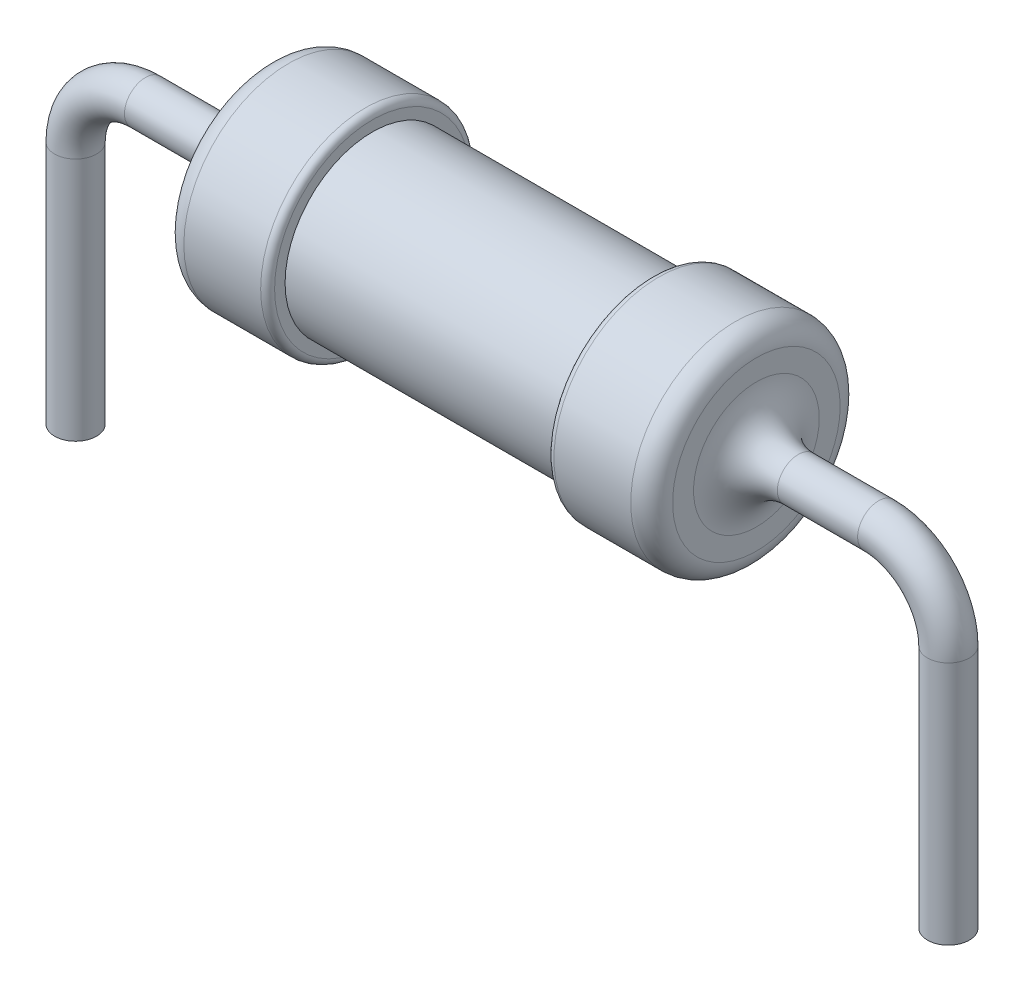
from build123d import *

# Parameters (mm, degrees)
SKETCH_1_R           = 1.25
EXTRUDE_1_DEPTH      = 2.5
EXTRUDE_3_DEPTH      = 1
EXTRUDE_3_DEPTH_BACK = 0.5
SKETCH_2_R           = 1.5
EXTRUDE_4_DEPTH      = 1
EXTRUDE_4_DEPTH_BACK = 0.5
SKETCH_3_R           = 1.5
SWEEP_1_OUTLINE_R    = 0.3
SWEEP_1_ANGLE        = 90
SWEEP_1_2_OUTLINE_R  = 0.3
SWEEP_1_2_ANGLE      = 90
SWEEP_START          = -4.5
SWEEP_1_3_OUTLINE_R  = 0.3
SWEEP_1_3_DEPTH      = 3.5000001
SWEEP_START_2        = -5.2500001
SWEEP_1_4_OUTLINE_R  = 0.3
SWEEP_1_4_DEPTH      = 2.2500001
SWEEP_START_3        = 3
SWEEP_1_5_OUTLINE_R  = 0.3
SWEEP_1_5_DEPTH      = 2.2500001
SWEEP_1_6_OUTLINE_R  = 0.3
SWEEP_1_6_DEPTH      = 3.5000001
FILLET_1_R           = 0.6
FILLET_2_R           = 0.3
FILLET_3_R           = 0.1


with BuildPart() as part:
    # Эскиз1 → Бобышка-Вытянуть1 (new, symmetric)
    with BuildSketch(Plane(origin=(0, 0, 0), x_dir=(0, 0, -1), z_dir=(1, 0, 0))):
        Circle(SKETCH_1_R)
    extrude(amount=EXTRUDE_1_DEPTH, both=True)

    # Эскиз2 → Бобышка-Вытянуть3 (add, two sides: drawn at the far end of the back side and taken through both)
    with BuildSketch(Plane(origin=(2.5, 0, 0), x_dir=(0, 0, -1), z_dir=(1, 0, 0)).offset(-EXTRUDE_3_DEPTH_BACK)):
        Circle(SKETCH_2_R)
    extrude(amount=EXTRUDE_3_DEPTH + EXTRUDE_3_DEPTH_BACK)

    # Эскиз3 → Бобышка-Вытянуть4 (add, two sides: drawn at the far end of the back side and taken through both)
    with BuildSketch(Plane.ZY.offset(2.5).offset(-EXTRUDE_4_DEPTH_BACK)):
        with Locations(Location((0, 0, 0), (0, 0, 180))):
            Circle(SKETCH_3_R)
    extrude(amount=EXTRUDE_4_DEPTH + EXTRUDE_4_DEPTH_BACK)



with BuildPart() as body_2:
    # По траектории1: read off the stored shape, not the designer's step
    # По траектории1 outline → По траектории1 (revolve)
    with BuildSketch(Plane(origin=(-5.25, -1, 0), x_dir=(0, 1, 0), z_dir=(1, 0, 0))):
        with Locations((1, 0)):
            Circle(SWEEP_1_OUTLINE_R)
    revolve(axis=Axis((-5.25, -1, 0), (0, 0, 1)), revolution_arc=SWEEP_1_ANGLE)

    # Sweep 1 3 outline → Sweep 1 3 (add)
    with BuildSketch(Plane(origin=(0, 0, 0), x_dir=(1, 0, 0), z_dir=(0, 1, 0)).offset(SWEEP_START)):
        with Locations((-6.25, 0)):
            Circle(SWEEP_1_3_OUTLINE_R)
    extrude(amount=SWEEP_1_3_DEPTH)


with BuildPart() as body_3:
    # Sweep 1 2 outline → Sweep 1 2 (revolve)
    with BuildSketch(Plane(origin=(5.25, -1, 0), x_dir=(1, 0, 0), z_dir=(0, -1, 0))):
        with Locations((1, 0)):
            Circle(SWEEP_1_2_OUTLINE_R)
    revolve(axis=Axis((5.25, -1, 0), (0, 0, 1)), revolution_arc=SWEEP_1_2_ANGLE)


with BuildPart() as part_1:
    add(part.part)

    add(body_2.part)  # Sweep 1 4 merges body 2
    # Sweep 1 4 outline → Sweep 1 4 (add)
    with BuildSketch(Plane.YZ.offset(SWEEP_START_2)):
        Circle(SWEEP_1_4_OUTLINE_R)
    extrude(amount=SWEEP_1_4_DEPTH)


    add(body_3.part)  # Sweep 1 5 merges body 3
    # Sweep 1 5 outline → Sweep 1 5 (add)
    with BuildSketch(Plane.YZ.offset(SWEEP_START_3)):
        Circle(SWEEP_1_5_OUTLINE_R)
    extrude(amount=SWEEP_1_5_DEPTH)

    # Sweep 1 6 outline → Sweep 1 6 (add)
    with BuildSketch(Plane(origin=(0, 0, 0), x_dir=(1, 0, 0), z_dir=(0, 1, 0)).offset(SWEEP_START)):
        with Locations((6.25, 0)):
            Circle(SWEEP_1_6_OUTLINE_R)
    extrude(amount=SWEEP_1_6_DEPTH)

    # Скругление1
    fillet_1_edges = [part_1.edges().sort_by_distance(p)[0] for p in [
        (-3.5, -0.3, 0),
        (3.5, -0.3, 0),
    ]]
    fillet(fillet_1_edges, radius=FILLET_1_R)

    # Скругление2
    fillet_2_edges = [part_1.edges().sort_by_distance(p)[0] for p in [
        (-3.5, 0, 1.5),
        (3.5, 0, 1.5),
    ]]
    fillet(fillet_2_edges, radius=FILLET_2_R)

    # Скругление3
    fillet_3_edges = [part_1.edges().sort_by_distance(p)[0] for p in [
        (-2, 0, 1.5),
        (2, 0, 1.5),
    ]]
    fillet(fillet_3_edges, radius=FILLET_3_R)


solid = part_1.part
